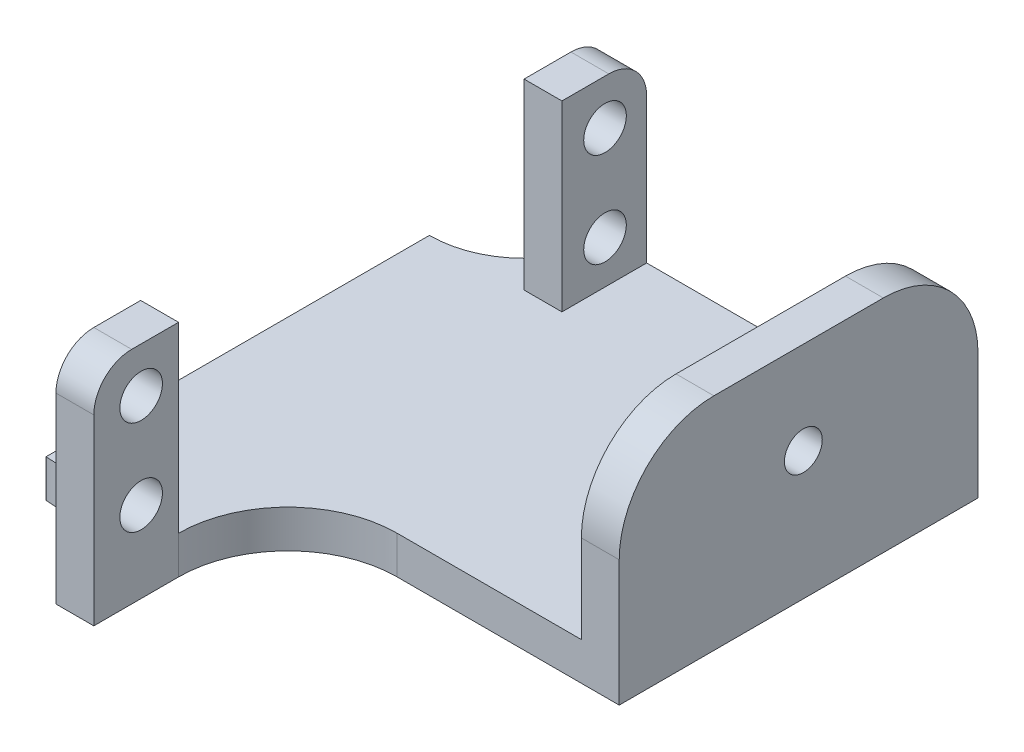
from build123d import *

# Parameters (mm, degrees)
BOSS_EXTRUDE1_DEPTH = 4
SKETCH2_W           = 8.95
SKETCH2_H           = 19.3
SKETCH2_R           = 2.25
BOSS_EXTRUDE2_DEPTH = 4
FILLET1_R           = 10
FILLET2_R           = 4
SKETCH3_W           = 58.4
SKETCH3_H           = 19.3
SKETCH3_R           = 2
BOSS_EXTRUDE3_DEPTH = 4
CUT_EXTRUDE1_REACH  = 81.715
FILLET3_R           = 10


with BuildPart() as part:
    # Sketch1 → Boss-Extrude1 (new body)
    with BuildSketch(Plane(origin=(0, 0, 0), x_dir=(1, 0, 0), z_dir=(0, 1, 0))):
        Polygon((-49, 49.45), (-39, 49.45), (-39, 58.4), (0, 58.4), (0, 0), (-39, 0), (-39, 8.95), (-49, 8.95), align=None)
    extrude(amount=BOSS_EXTRUDE1_DEPTH)

    # Sketch2 → Boss-Extrude2 (add)
    # profile 1 of 2: a face of its own
    with BuildSketch(Plane.ZY.offset(39)):
        with Locations((-4.475, 13.65)):
            Rectangle(SKETCH2_W, SKETCH2_H)
        with Locations((-5, 18.55)):
            Circle(SKETCH2_R, mode=Mode.SUBTRACT)
        with Locations((-5, 8.55)):
            Circle(SKETCH2_R, mode=Mode.SUBTRACT)
    # profile 2 of 2: a face of its own
    with BuildSketch(Plane.ZY.offset(39)):
        with Locations((-53.925, 13.65)):
            Rectangle(SKETCH2_W, SKETCH2_H)
        with Locations((-54, 18.55)):
            Circle(SKETCH2_R, mode=Mode.SUBTRACT)
        with Locations((-54, 8.55)):
            Circle(SKETCH2_R, mode=Mode.SUBTRACT)
    extrude(amount=-BOSS_EXTRUDE2_DEPTH)

    # Fillet1
    # the kernel refuses this fillet: 10 mm, written as the material it adds along each edge
    with BuildSketch(Plane(origin=(-39, 0, -49.45), x_dir=(-1, 0, 0), z_dir=(0, 1, 0))) as fillet1_piece_1:
        with BuildLine():
            CenterArc((9.944722218, -10), FILLET1_R, 90, 83.97283344)
            Line((0, -8.95), (0, 0))
            Line((0, 0), (9.944722218, 0))
        make_face()
    extrude(amount=4)
    with BuildSketch(Plane(origin=(-39, 0, -8.95), x_dir=(0, 0, 1), z_dir=(0, 1, 0))) as fillet1_piece_2:
        with BuildLine():
            CenterArc((10, -9.944722218), FILLET1_R, 96.02716656, 83.97283344)
            Line((0, -9.944722218), (0, 0))
            Line((0, 0), (8.95, 0))
        make_face()
    extrude(amount=4)

    # Fillet2
    fillet2_edges = [part.edges().sort_by_distance(p)[0] for p in [
        (-37, 23.3, 0),
        (-37, 23.3, -58.4),
    ]]
    fillet(fillet2_edges, radius=FILLET2_R)

    # Sketch3 → Boss-Extrude3 (add)
    with BuildSketch(Plane(origin=(0, 0, 0), x_dir=(0, 0, -1), z_dir=(1, 0, 0))):
        with Locations((29.2, 13.65)):
            Rectangle(SKETCH3_W, SKETCH3_H)
        with Locations((39.95, 13.55)):
            Circle(SKETCH3_R, mode=Mode.SUBTRACT)
    extrude(amount=-BOSS_EXTRUDE3_DEPTH)

    # Sketch4 → Cut-Extrude1 (cut, up to next)
    with BuildSketch(Plane.XZ, mode=Mode.PRIVATE) as cut_extrude1_sk1:
        with BuildLine():
            Line((0, 0), (0, -20.5))
            Line((0, -20.5), (-23.45, -20.5))
            ThreePointArc((-23.45, -20.5), (-31.617083323, -17.117083323), (-35, -8.95))
            Line((-35, -8.95), (-35, 0))
            Line((-35, 0), (0, 0))
        make_face()
    cut_extrude1_tool1 = extrude(cut_extrude1_sk1.sketch, amount=-CUT_EXTRUDE1_REACH, mode=Mode.PRIVATE) & part.part
    add(cut_extrude1_tool1.solids().sort_by_distance((-16.879944, 0, -9.931243))[0], mode=Mode.SUBTRACT)

    # Fillet3
    fillet3_edges = [part.edges().sort_by_distance(p)[0] for p in [
        (-2, 23.3, -20.5),
        (-2, 23.3, -58.4),
    ]]
    fillet(fillet3_edges, radius=FILLET3_R)


solid = part.part
